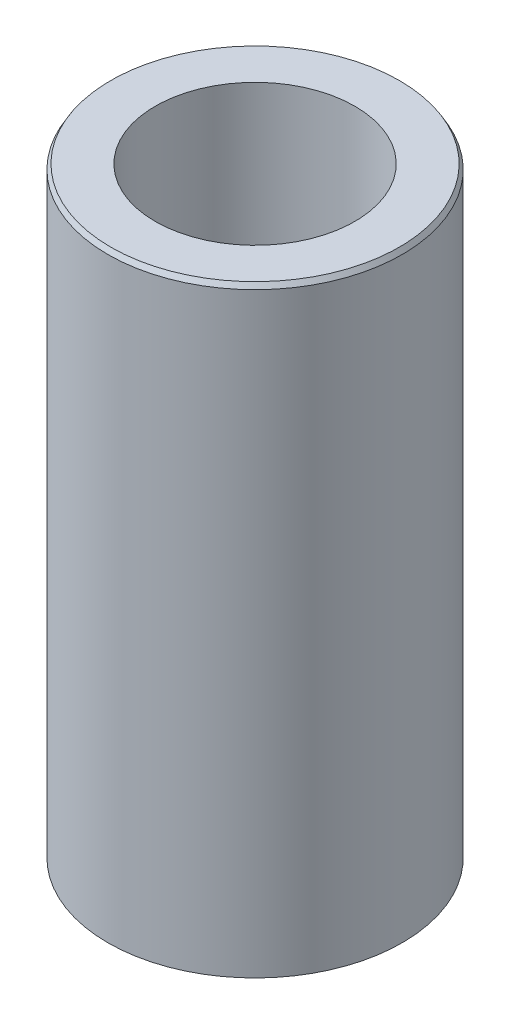
from build123d import *
from OCP.BRepFilletAPI import BRepFilletAPI_MakeChamfer

# Parameters (mm, degrees)
SKETCH1_R           = 35
BOSS_EXTRUDE1_DEPTH = 143.595371788
SKETCH2_R           = 23.740378123
CUT_EXTRUDE1_DEPTH  = 152.886901341
CHAMFER1_SIZE       = 1.176712413
CHAMFER1_SIZE2      = 0.679375228


with BuildPart() as part:
    # Sketch1 → Boss-Extrude1 (new body)
    with BuildSketch(Plane(origin=(0, 0, 0), x_dir=(1, 0, 0), z_dir=(0, 1, 0))):
        Circle(SKETCH1_R)
    extrude(amount=BOSS_EXTRUDE1_DEPTH)

    # Sketch2 → Cut-Extrude1 (cut, through all)
    with BuildSketch(Plane(origin=(0, 0, 0), x_dir=(1, 0, 0), z_dir=(0, 1, 0))):
        Circle(SKETCH2_R)
    extrude(amount=CUT_EXTRUDE1_DEPTH, mode=Mode.SUBTRACT)

    # Chamfer1: one chamfer whose edges measure the first distance from different faces: ONE call of the kernel's chamfer builder (chamfer() names one face for all edges)
    chamfer1_edges_1 = [part.edges().sort_by_distance(p)[0] for p in [
        (-35, 143.595371788, 0),
    ]]
    chamfer1_side_1 = [part.faces().sort_by_distance(p)[0] for p in [
        (-35, 71.797685894, 0),
    ]]
    chamfer1_edges_2 = [part.edges().sort_by_distance(p)[0] for p in [
        (-35, 0, 0),
    ]]
    chamfer1_side_2 = [part.faces().sort_by_distance(p)[0] for p in [
        (-34.010050506, 0, 0),
    ]]
    chamfer1 = BRepFilletAPI_MakeChamfer(part.part.solid().wrapped)
    for e in chamfer1_edges_1:
        chamfer1.Add(CHAMFER1_SIZE, CHAMFER1_SIZE2, e.wrapped, chamfer1_side_1[0].wrapped)  # the first distance lies on this face
    for e in chamfer1_edges_2:
        chamfer1.Add(CHAMFER1_SIZE, CHAMFER1_SIZE2, e.wrapped, chamfer1_side_2[0].wrapped)  # the first distance lies on this face
    add(Compound.cast(chamfer1.Shape()), mode=Mode.REPLACE)


solid = part.part
